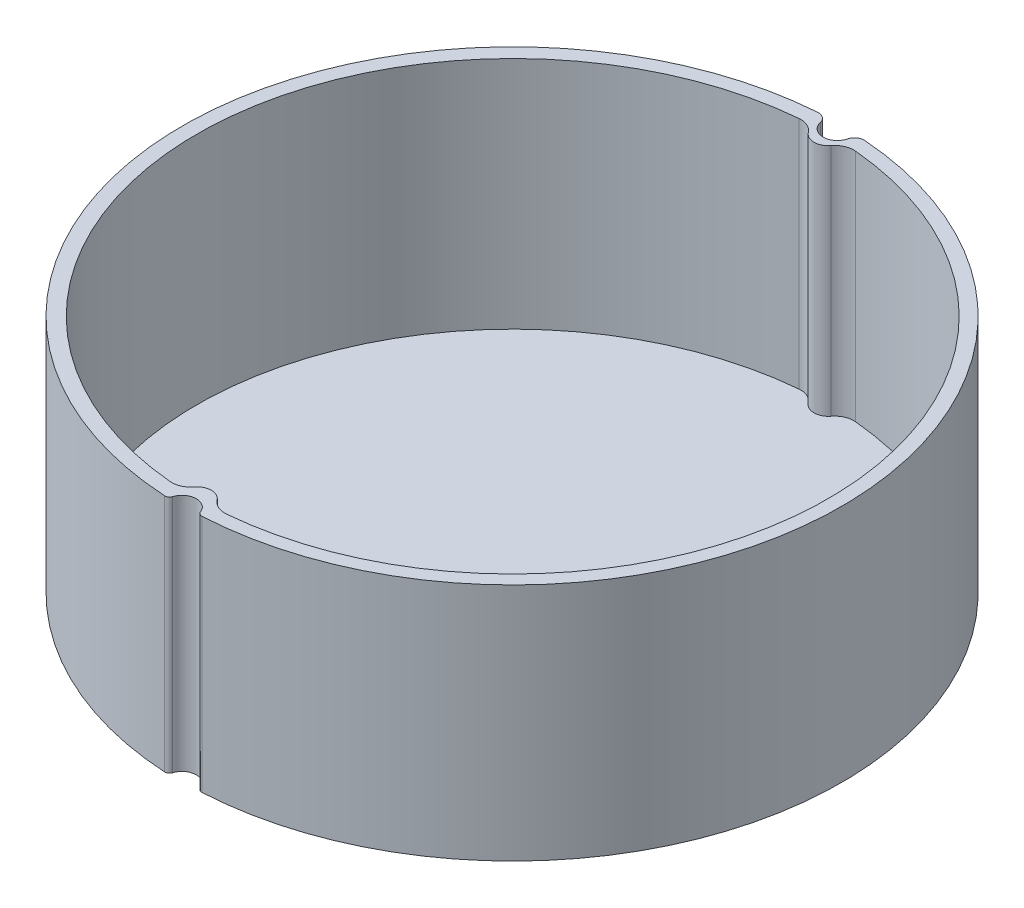
from build123d import *

# Parameters (mm, degrees)
BOSS_EXTRUDE1_DEPTH = 25
CUT_EXTRUDE2_DEPTH  = 55.784116745
BOSS_EXTRUDE2_DEPTH = 0.5


with BuildPart() as part:
    # Sketch1 → Boss-Extrude1 (new body)
    with BuildSketch(Plane(origin=(0, 0, 0), x_dir=(1, 0, 0), z_dir=(0, 1, 0))):
        with BuildLine():
            ThreePointArc((1.388184439, -34.024526654), (1.582903075, -34.267692689), (1.883792339, -34.348381715))
            ThreePointArc((1.883792339, -34.348381715), (24.448065102, -24.200250262), (34.365790759, -1.53376189))
            ThreePointArc((34.365790759, -1.53376189), (25.706615752, 22.858913066), (2.493104989, 34.309538433))
            ThreePointArc((2.493104989, 34.309538433), (1.837317334, 34.124415112), (1.452378604, 33.562142698))
            ThreePointArc((1.452378604, 33.562142698), (-0.029391592, 32.437392534), (-1.46595483, 33.619336656))
            ThreePointArc((-1.46595483, 33.619336656), (-1.844328043, 34.20829277), (-2.516198277, 34.404827707))
            ThreePointArc((-2.516198277, 34.404827707), (-25.784489967, 22.916882433), (-34.462378171, -1.538802818))
            ThreePointArc((-34.462378171, -1.538802818), (-24.537991164, -24.246863982), (-1.949992086, -34.441558533))
            ThreePointArc((-1.949992086, -34.441558533), (-1.638342507, -34.354295246), (-1.445420769, -34.094446164))
            ThreePointArc((-1.445420769, -34.094446164), (-0.053498551, -33.05116711), (1.388184439, -34.024526654))
        make_face()
        with BuildLine():
            Line((-2.417, 3.18717916), (0, 3.18717916))
            Line((0, 3.18717916), (2.417, 3.18717916))
            ThreePointArc((2.417, 3.18717916), (0, -4), (-2.417, 3.18717916))
        make_face(mode=Mode.SUBTRACT)
    extrude(amount=BOSS_EXTRUDE1_DEPTH)

    # Sketch2 → Cut-Extrude2 (cut, through all)
    with BuildSketch(Plane(origin=(0, 0, 0), x_dir=(1, 0, 0), z_dir=(0, 1, 0))):
        with BuildLine():
            ThreePointArc((-32.866935484, -2.96049859), (-23.334523779, -23.334523779), (-2.96049859, -32.866935484))
            ThreePointArc((-2.96049859, -32.866935484), (-1.9760642, -32.705835472), (-1.191889043, -32.089285714))
            ThreePointArc((-1.191889043, -32.089285714), (0, -31.5), (1.191889043, -32.089285714))
            ThreePointArc((1.191889043, -32.089285714), (1.9760642, -32.705835472), (2.96049859, -32.866935484))
            ThreePointArc((2.96049859, -32.866935484), (23.334523779, -23.334523779), (32.866935484, -2.96049859))
            ThreePointArc((32.866935484, -2.96049859), (25.333821586, 21.147044329), (2.96049859, 32.866935484))
            ThreePointArc((2.96049859, 32.866935484), (1.9760642, 32.705835472), (1.191889043, 32.089285714))
            ThreePointArc((1.191889043, 32.089285714), (0, 31.5), (-1.191889043, 32.089285714))
            ThreePointArc((-1.191889043, 32.089285714), (-1.9760642, 32.705835472), (-2.96049859, 32.866935484))
            ThreePointArc((-2.96049859, 32.866935484), (-25.333821586, 21.147044329), (-32.866935484, -2.96049859))
        make_face()
    extrude(amount=CUT_EXTRUDE2_DEPTH, mode=Mode.SUBTRACT)

    # Sketch2<2> → Boss-Extrude2 (add)
    with BuildSketch(Plane(origin=(0, 0, 0), x_dir=(1, 0, 0), z_dir=(0, 1, 0))):
        with BuildLine():
            ThreePointArc((-32.866935484, -2.96049859), (-23.334523779, -23.334523779), (-2.96049859, -32.866935484))
            ThreePointArc((-2.96049859, -32.866935484), (-1.9760642, -32.705835472), (-1.191889043, -32.089285714))
            ThreePointArc((-1.191889043, -32.089285714), (0, -31.5), (1.191889043, -32.089285714))
            ThreePointArc((1.191889043, -32.089285714), (1.9760642, -32.705835472), (2.96049859, -32.866935484))
            ThreePointArc((2.96049859, -32.866935484), (23.334523779, -23.334523779), (32.866935484, -2.96049859))
            ThreePointArc((32.866935484, -2.96049859), (25.333821586, 21.147044329), (2.96049859, 32.866935484))
            ThreePointArc((2.96049859, 32.866935484), (1.9760642, 32.705835472), (1.191889043, 32.089285714))
            ThreePointArc((1.191889043, 32.089285714), (0, 31.5), (-1.191889043, 32.089285714))
            ThreePointArc((-1.191889043, 32.089285714), (-1.9760642, 32.705835472), (-2.96049859, 32.866935484))
            ThreePointArc((-2.96049859, 32.866935484), (-25.333821586, 21.147044329), (-32.866935484, -2.96049859))
        make_face()
    extrude(amount=BOSS_EXTRUDE2_DEPTH)


solid = part.part
